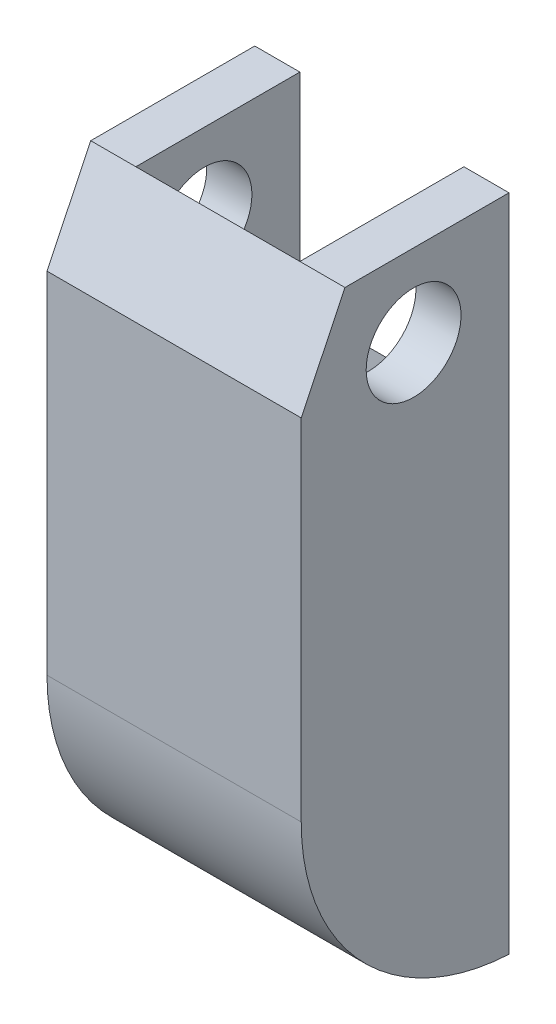
from build123d import *

# Parameters (mm, degrees)
SKETCH1_W               = 11.811
SKETCH1_H               = 45.98924
BOSS_EXTRUDE1_DEPTH     = 9.652
FILLET5_R               = 4.826
SKETCH2_W               = 7.62
SKETCH2_H               = 22.352
CUT_EXTRUDE1_DEPTH      = 7.62
CUT_EXTRUDE2_DEPTH      = 49.452771033
CUT_EXTRUDE2_DEPTH_BACK = 49.452771033
SKETCH3_R               = 2.20345
FILLET4_R               = 4.826
FILLET6_R               = 10.16
CUT_EXTRUDE3_DEPTH      = 49.452771033
CUT_EXTRUDE4_DEPTH      = 7.62
BOSS_EXTRUDE2_DEPTH     = 7.62


with BuildPart() as part:
    # Sketch1 → Boss-Extrude1 (new body)
    with BuildSketch(Plane.XY):
        with Locations((5.9055, 22.99462)):
            Rectangle(SKETCH1_W, SKETCH1_H)
    extrude(amount=BOSS_EXTRUDE1_DEPTH)

    # Fillet5
    fillet5_edges = [part.edges().sort_by_distance(p)[0] for p in [
        (5.9055, 45.98924, 0),
    ]]
    fillet(fillet5_edges, radius=FILLET5_R)

    # Sketch2 → Cut-Extrude1 (cut)
    with BuildSketch(Plane(origin=(0, 0, 0), x_dir=(-1, 0, 0), z_dir=(0, 0, -1))):
        with Locations((-5.9055, 34.81324)):
            Rectangle(SKETCH2_W, SKETCH2_H)
    extrude(amount=-CUT_EXTRUDE1_DEPTH, mode=Mode.SUBTRACT)

    # Sketch3 → Cut-Extrude2 (cut, two sides: drawn at the far end of the back side and taken through both)
    with BuildSketch(Plane.ZY.offset(-CUT_EXTRUDE2_DEPTH_BACK)):
        with Locations((4.4323, 26.82494)):
            Circle(SKETCH3_R)
    extrude(amount=CUT_EXTRUDE2_DEPTH + CUT_EXTRUDE2_DEPTH_BACK, mode=Mode.SUBTRACT)

    # Fillet4
    # the kernel refuses this fillet: 4.826 mm, written as the material it takes off along each edge
    with BuildSketch(Plane(origin=(23.876, 45.98924, 9.652), x_dir=(0, 0, -1), z_dir=(-1, 0, 0))) as fillet4_piece_1:
        with BuildLine():
            CenterArc((FILLET4_R, FILLET4_R), FILLET4_R, 180, 90)
            Line((0, FILLET4_R), (0, 0))
            Line((0, 0), (FILLET4_R, 0))
        make_face()
    extrude(amount=35.941, mode=Mode.SUBTRACT)

    # Fillet6
    # the kernel refuses this fillet: 10.16 mm, written as the material it takes off along each edge
    with BuildSketch(Plane(origin=(-25.368230131, 0, 9.652), x_dir=(0, 1, 0), z_dir=(1, 0, 0))) as fillet6_piece_1:
        with BuildLine():
            CenterArc((10.147292053, -10.16), FILLET6_R, 90, 87.134016017)
            Line((0, -9.652), (-0.202945841, -9.64184))
            ThreePointArc((-0.202945841, -9.64184), (-0.2032, -4.826), (-0.2032, 0))
            Line((-0.2032, 0), (0, 0.2032))
            Line((0, 0.2032), (10.147292053, 0.2032))
            Line((10.147292053, 0.2032), (10.147292053, 0))
        make_face()
    extrude(amount=62.547460263, mode=Mode.SUBTRACT)

    # Sketch4 → Cut-Extrude3 (cut, through all)
    with BuildSketch(Plane(origin=(11.811, 0, 0), x_dir=(0, 0, -1), z_dir=(1, 0, 0))):
        Polygon((-9.652, 26.403813088), (-7.62, 30.63494), (0, 30.63494), (0, 45.98924), (-9.652, 45.98924), align=None)
    extrude(amount=-CUT_EXTRUDE3_DEPTH, mode=Mode.SUBTRACT)

    # Sketch5 → Cut-Extrude4 (cut)
    with BuildSketch(Plane.ZY.offset(-9.7155)):
        Polygon((0, 21.160076085), (5.158068358, 23.63724), (0, 23.63724), align=None)
    extrude(amount=CUT_EXTRUDE4_DEPTH, mode=Mode.SUBTRACT)

    # Sketch5<3> → Boss-Extrude2 (add)
    with BuildSketch(Plane.ZY.offset(-9.7155)):
        with BuildLine():
            Line((5.812301369, 23.951435604), (5.158068358, 23.63724))
            Line((5.158068358, 23.63724), (7.62, 23.63724))
            Line((7.62, 23.63724), (7.62, 26.82494))
            ThreePointArc((7.62, 26.82494), (7.130490287, 25.127530072), (5.812301369, 23.951435604))
        make_face()
    extrude(amount=BOSS_EXTRUDE2_DEPTH)


solid = part.part
